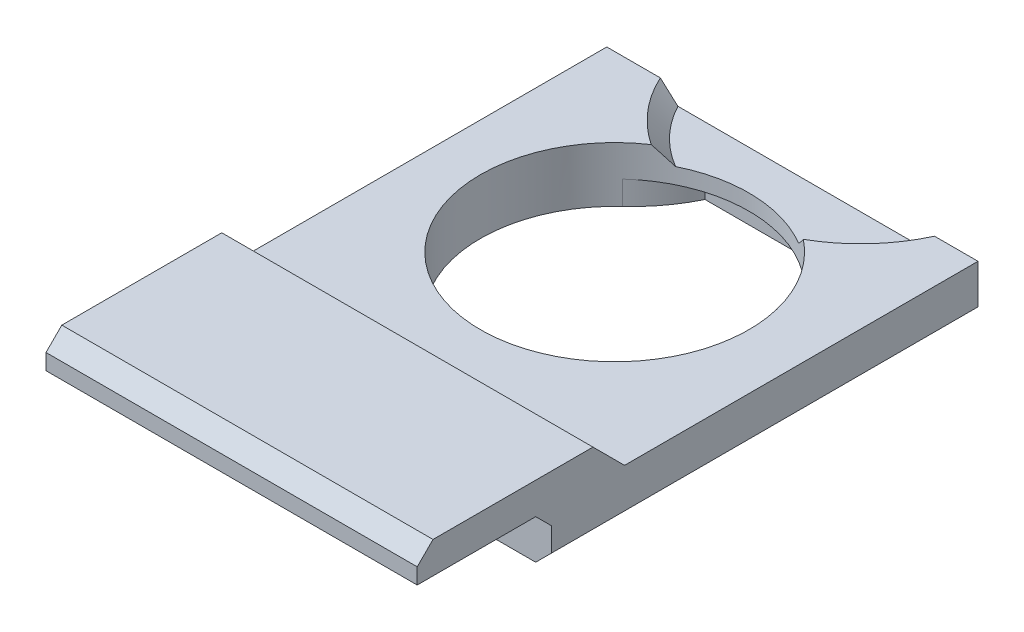
from build123d import *

# Parameters (mm, degrees)
SKETCH1_W           = 23.5
SKETCH1_H           = 28
BOSS_EXTRUDE1_DEPTH = 3.5
CHAMFER1_SIZE       = 1
SKETCH2_R           = 8.5
CUT_EXTRUDE1_DEPTH  = 3.5
SKETCH3_R           = 9.555523526
CUT_EXTRUDE3_DEPTH  = 1
CHAMFER2_SIZE       = 1
SKETCH4_W           = 23.5
SKETCH4_H           = 9.126491789
BOSS_EXTRUDE2_DEPTH = 2
CHAMFER3_SIZE       = 2
CHAMFER4_SIZE       = 1
SKETCH5_W           = 7.502434646
SKETCH5_H           = 2.891999948
CUT_EXTRUDE4_DEPTH  = 1.5
FILLET1_R           = 10
SKETCH6_W           = 23.5
SKETCH6_H           = 2
BOSS_EXTRUDE3_DEPTH = 2
SKETCH7_W           = 25.736202914
SKETCH7_H           = 1.90415655
CUT_EXTRUDE6_DEPTH  = 7
CHAMFER5_SIZE       = 1


# Some blends are built 0.0001 mm under size
with BuildPart() as part:
    # Sketch1 → Boss-Extrude1 (new body)
    with BuildSketch(Plane(origin=(0, 0, 0), x_dir=(1, 0, 0), z_dir=(0, 1, 0))):
        with Locations((-1.454397394, -2.840390879)):
            Rectangle(SKETCH1_W, SKETCH1_H)
    extrude(amount=BOSS_EXTRUDE1_DEPTH)

    # Chamfer1
    chamfer1_edges = [part.edges().sort_by_distance(p)[0] for p in [
        (-1.454397394, 0, -11.159609121),
        (10.295602606, 0, 2.840390879),
        (-13.204397394, 0, 2.840390879),
    ]]
    chamfer(chamfer1_edges, length=CHAMFER1_SIZE)

    # Sketch2 → Cut-Extrude1 (cut)
    with BuildSketch(Plane(origin=(0, 3.5, 0), x_dir=(1, 0, 0), z_dir=(0, 1, 0))):
        with Locations(Location((-1.704397394, -0.840390879, 0), (0, 0, 270))):
            Circle(SKETCH2_R)
    extrude(amount=-CUT_EXTRUDE1_DEPTH, mode=Mode.SUBTRACT)

    # Sketch3 → Cut-Extrude3 (cut)
    with BuildSketch(Plane(origin=(0, 3.5, 0), x_dir=(1, 0, 0), z_dir=(0, 1, 0))):
        with Locations((-1.135292968, 14.156160389)):
            Circle(SKETCH3_R)
    extrude(amount=-CUT_EXTRUDE3_DEPTH, mode=Mode.SUBTRACT)

    # Chamfer2
    chamfer2_edges = [part.edges().sort_by_distance(p)[0] for p in [
        (-8.74141347, 2.5, -8.372134044),
        (6.246016299, 2.5, -8.087857218),
    ]]
    chamfer(chamfer2_edges, length=CHAMFER2_SIZE - 0.0001)  # a hair under: the kernel refuses the full size

    # Sketch4 → Boss-Extrude2 (add)
    with BuildSketch(Plane(origin=(0, 3.5, 0), x_dir=(1, 0, 0), z_dir=(0, 1, 0))):
        with Locations((-1.454397394, -18.777144985)):
            Rectangle(SKETCH4_W, SKETCH4_H)
    extrude(amount=BOSS_EXTRUDE2_DEPTH)

    # Chamfer3
    chamfer3_edges = [part.edges().sort_by_distance(p)[0] for p in [
        (-1.454397394, 3.5, 14.21389909),
    ]]
    chamfer(chamfer3_edges, length=CHAMFER3_SIZE - 0.0001)  # a hair under: the kernel refuses the full size

    # Chamfer4
    chamfer4_edges = [part.edges().sort_by_distance(p)[0] for p in [
        (-1.454397394, 3.5, 16.840390879),
    ]]
    chamfer(chamfer4_edges, length=CHAMFER4_SIZE)

    # Sketch5 → Cut-Extrude4 (cut)
    with BuildSketch(Plane.XZ):
        with Locations((-1.480612468, -6.958763205)):
            Rectangle(SKETCH5_W, SKETCH5_H)
    extrude(amount=-CUT_EXTRUDE4_DEPTH, mode=Mode.SUBTRACT)

    # Fillet1
    # the kernel refuses this fillet: 10 mm, written as the material it takes off along each edge
    with BuildSketch(Plane(origin=(2.270604855, -6.676580089, -6.67288784), x_dir=(0.799474341505259, 0, 0.6007002391165933), z_dir=(0, 1, 0))) as fillet1_piece_1:
        with BuildLine():
            CenterArc((4.241592057, 9.875833363), FILLET1_R, 238.116555861, 22.84506635)
            Line((-1.04033793, 1.384589896), (0, 0))
            ThreePointArc((0, 0), (1.335316018, 0.105541642), (2.670632036, 0))
        make_face()
    extrude(amount=8.176580089, mode=Mode.SUBTRACT)
    with BuildSketch(Plane(origin=(-5.231829791, -6.674182658, -6.89312195), x_dir=(-0.8333660281094135, 0, 0.552721505998401), z_dir=(0, 1, 0))) as fillet1_piece_2:
        with BuildLine():
            CenterArc((4.240068983, -9.875923079), FILLET1_R, 99.035105105, 21.466237943)
            Line((-0.835516616, -1.259750447), (0, 0))
            ThreePointArc((0, 0), (1.334836532, -0.105465383), (2.669673063, 0))
        make_face()
    extrude(amount=8.174182658, mode=Mode.SUBTRACT)

    # Sketch6 → Boss-Extrude3 (add)
    with BuildSketch(Plane.XY.offset(23.340390879)):
        with Locations((-1.454397394, 4.5)):
            Rectangle(SKETCH6_W, SKETCH6_H)
    extrude(amount=BOSS_EXTRUDE3_DEPTH)

    # Sketch7 → Cut-Extrude6 (cut)
    with BuildSketch(Plane(origin=(0, 3.5, 0), x_dir=(1, 0, 0), z_dir=(0, 1, 0))):
        with Locations((-1.767118607, 11.111687396)):
            Rectangle(SKETCH7_W, SKETCH7_H)
    extrude(amount=-CUT_EXTRUDE6_DEPTH, mode=Mode.SUBTRACT)

    # Chamfer5
    chamfer5_edges = [part.edges().sort_by_distance(p)[0] for p in [
        (-1.454397394, 5.5, 25.340390879),
    ]]
    chamfer(chamfer5_edges, length=CHAMFER5_SIZE)


solid = part.part
